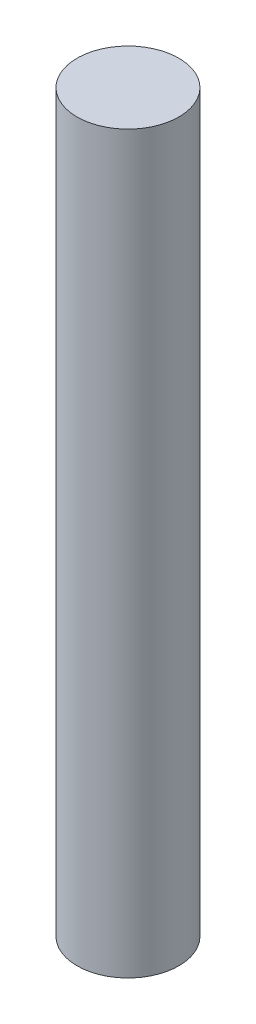
from build123d import *

# Parameters (mm, degrees)
SKETCH1_R           = 25
BOSS_EXTRUDE1_DEPTH = 361


with BuildPart() as part:
    # Sketch1 → Boss-Extrude1 (new body)
    with BuildSketch(Plane(origin=(0, 0, 0), x_dir=(1, 0, 0), z_dir=(0, 1, 0))):
        Circle(SKETCH1_R)
    extrude(amount=-BOSS_EXTRUDE1_DEPTH)


solid = part.part
